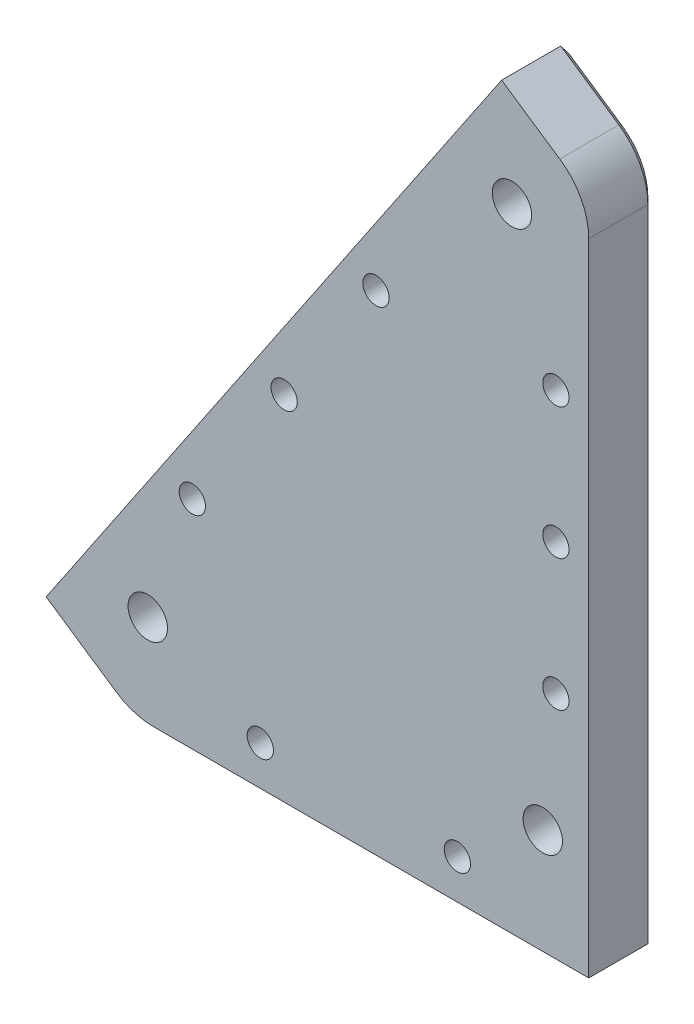
from build123d import *

# Parameters (mm, degrees)
SKETCH_1_R          = 3
SKETCH_1_R_2        = 2
EXTRUDE_1_DEPTH     = 10
SKETCH_2_R          = 4
CUT_EXTRUDE_1_DEPTH = 1.5
CHAMFER_1_SIZE      = 1


with BuildPart() as part:
    # Эскиз1 → Бобышка-Вытянуть1 (new body)
    with BuildSketch(Plane.XY):
        with BuildLine():
            Line((41.302260596, -55.873872726), (41.302260596, 41.609691954))
            ThreePointArc((41.302260596, 41.609691954), (40.131736524, 46.304407582), (36.89418963, 49.90006768))
            Line((36.89418963, 49.90006768), (28.037659435, 55.873872726))
            Line((28.037659435, 55.873872726), (-41.302260596, -46.926786271))
            Line((-41.302260596, -46.926786271), (-30.572281655, -54.164248452))
            ThreePointArc((-30.572281655, -54.164248452), (-27.904069667, -55.436920286), (-24.98035262, -55.873872726))
            Line((-24.98035262, -55.873872726), (41.302260596, -55.873872726))
        make_face()
        with Locations((34.302260596, -39.873872726)):
            Circle(SKETCH_1_R, mode=Mode.SUBTRACT)
        with Locations((29.617720319, 40.333492821)):
            Circle(SKETCH_1_R, mode=Mode.SUBTRACT)
        with Locations((-25.83184789, -41.873872726)):
            Circle(SKETCH_1_R, mode=Mode.SUBTRACT)
        with Locations((-19.047275812, -22.873872726)):
            Circle(SKETCH_1_R_2, mode=Mode.SUBTRACT)
        with Locations((-5.067453226, -2.147933412)):
            Circle(SKETCH_1_R_2, mode=Mode.SUBTRACT)
        with Locations((8.912369361, 18.578005902)):
            Circle(SKETCH_1_R_2, mode=Mode.SUBTRACT)
        with Locations((-8.697739404, -49.873872726)):
            Circle(SKETCH_1_R_2, mode=Mode.SUBTRACT)
        with Locations((21.302260596, -49.873872726)):
            Circle(SKETCH_1_R_2, mode=Mode.SUBTRACT)
        with Locations((36.302260596, 19.126127274)):
            Circle(SKETCH_1_R_2, mode=Mode.SUBTRACT)
        with Locations((36.302260596, -0.873872726)):
            Circle(SKETCH_1_R_2, mode=Mode.SUBTRACT)
        with Locations((36.302260596, -20.873872726)):
            Circle(SKETCH_1_R_2, mode=Mode.SUBTRACT)
    extrude(amount=EXTRUDE_1_DEPTH)

    # Эскиз2 → Вырез-Вытянуть1 (cut)
    with BuildSketch(Plane(origin=(0, 0, 0), x_dir=(-1, 0, 0), z_dir=(0, 0, -1))):
        with Locations((-36.302260596, 19.126127274)):
            Circle(SKETCH_2_R)
        with Locations((-36.302260596, -0.873872726)):
            Circle(SKETCH_2_R)
        with Locations((-36.302260596, -20.873872726)):
            Circle(SKETCH_2_R)
        with Locations((-21.302260596, -49.873872726)):
            Circle(SKETCH_2_R)
        with Locations((8.697739404, -49.873872726)):
            Circle(SKETCH_2_R)
        with Locations((19.047275812, -22.873872726)):
            Circle(SKETCH_2_R)
        with Locations((5.067453226, -2.147933412)):
            Circle(SKETCH_2_R)
        with Locations((-8.912369361, 18.578005902)):
            Circle(SKETCH_2_R)
    extrude(amount=-CUT_EXTRUDE_1_DEPTH, mode=Mode.SUBTRACT)

    # Фаска1
    chamfer_1_edges = [part.edges().sort_by_distance(p)[0] for p in [
        (8.160953988, -55.873872726, 0),
        (-27.904069667, -55.436920286, 0),
        (-35.937271125, -50.545517361, 0),
        (-6.63230058, 4.473543228, 0),
        (32.465924533, 52.886970203, 0),
        (40.131736524, 46.304407582, 0),
        (41.302260596, -7.132090386, 0),
    ]]
    chamfer(chamfer_1_edges, length=CHAMFER_1_SIZE - 0.0001)  # a hair under: the kernel refuses the full size


solid = part.part
